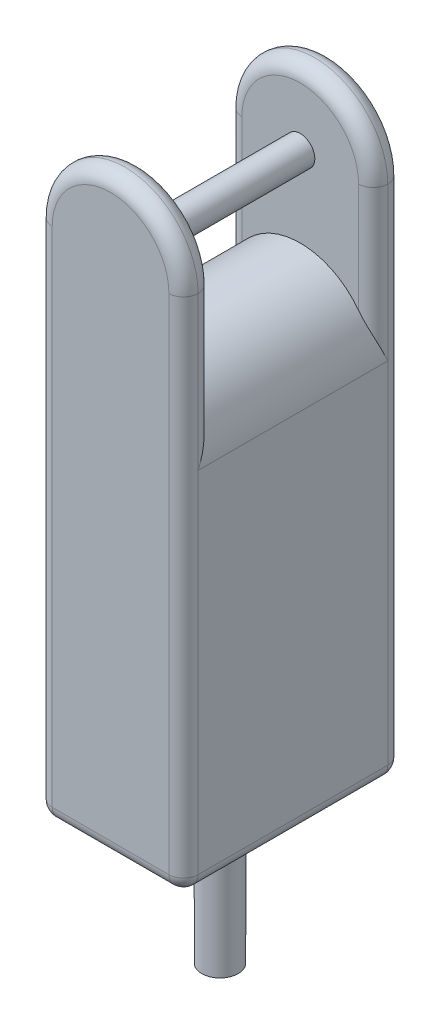
from build123d import *

# Parameters (mm, degrees)
SKETCH2_W           = 100
SKETCH2_H           = 300
BOSS_EXTRUDE1_DEPTH = 75
CUT_EXTRUDE1_REACH  = 422.463
CUT_EXTRUDE1_START  = 150
SKETCH3_W           = 100
SKETCH3_H           = 110
SKETCH4_R           = 10
BOSS_EXTRUDE2_DEPTH = 110
SKETCH5_R           = 12.5
BOSS_EXTRUDE3_DEPTH = 100
FILLET1_RADIUS      = 50
FILLET1_LENGTH      = 110
FILLET2_R           = 10
FILLET3_R           = 10


with BuildPart() as part:
    # Sketch2 → Boss-Extrude1 (new, symmetric)
    with BuildSketch(Plane.XY):
        Rectangle(SKETCH2_W, SKETCH2_H)
        with BuildLine():
            ThreePointArc((-50, 205), (0, 255), (50, 205))
            Line((50, 205), (50, 150))
            Line((50, 150), (-50, 150))
            Line((-50, 150), (-50, 205))
        make_face()
    extrude(amount=BOSS_EXTRUDE1_DEPTH, both=True)

    # Sketch3 → Cut-Extrude1 (cut, up to next)
    with BuildSketch(Plane(origin=(0, 0, 0), x_dir=(1, 0, 0), z_dir=(0, 1, 0)).offset(CUT_EXTRUDE1_START), mode=Mode.PRIVATE) as cut_extrude1_sk1:
        Rectangle(SKETCH3_W, SKETCH3_H)
    cut_extrude1_tool1 = extrude(cut_extrude1_sk1.sketch, amount=CUT_EXTRUDE1_REACH, mode=Mode.PRIVATE) & part.part
    add(cut_extrude1_tool1.solids().sort_by_distance((0, 150, 0))[0], mode=Mode.SUBTRACT)

    # Sketch4 → Boss-Extrude2 (add)
    with BuildSketch(Plane.XY.offset(-55)):
        with Locations(Location((0, 205, 0), (0, 0, 180))):
            Circle(SKETCH4_R)
    extrude(amount=BOSS_EXTRUDE2_DEPTH)

    # Sketch5 → Boss-Extrude3 (add)
    with BuildSketch(Plane.XZ.offset(150)):
        with Locations(Location((0, 0, 0), (0, 0, 90))):
            Circle(SKETCH5_R)
    extrude(amount=BOSS_EXTRUDE3_DEPTH)

    # Fillet1: full round fillet: the end face becomes a half cylinder, R = half its width
    fillet1_face = Plane((0, 150, 0), x_dir=(0, 0, -1), z_dir=(0, 1, 0))  # on the end face: x along it, z out of the body
    fillet1_slab = fillet1_face.offset(-FILLET1_RADIUS / 2) * Box(FILLET1_LENGTH, 2 * FILLET1_RADIUS, FILLET1_RADIUS, mode=Mode.PRIVATE)  # the body's end, R deep
    fillet1_round = Plane((0, 100, 0), x_dir=(0, 1, 0), z_dir=(0, 0, -1)) * Cylinder(FILLET1_RADIUS, FILLET1_LENGTH, mode=Mode.PRIVATE)  # its axis R under the face
    add(fillet1_slab - fillet1_round, mode=Mode.SUBTRACT)

    # Fillet2
    fillet2_edges = [part.edges().sort_by_distance(p)[0] for p in [
        (0, 255, 75),
        (-50, 27.5, 75),
        (0, -150, 75),
        (50, 27.5, 75),
        (0, -150, -75),
        (-50, 27.5, -75),
        (0, 255, -75),
        (50, 27.5, -75),
        (50, -150, 0),
        (-50, -150, 0),
    ]]
    fillet(fillet2_edges, radius=FILLET2_R)

    # Fillet3
    fillet3_edges = [part.edges().sort_by_distance(p)[0] for p in [
        (50, 152.5, 55),
        (0, 255, 55),
        (50, 152.5, -55),
        (0, 255, -55),
        (-50, 152.5, 55),
        (-50, 152.5, -55),
    ]]
    fillet(fillet3_edges, radius=FILLET3_R - 0.0001)  # a hair under: the kernel refuses the full size


solid = part.part
